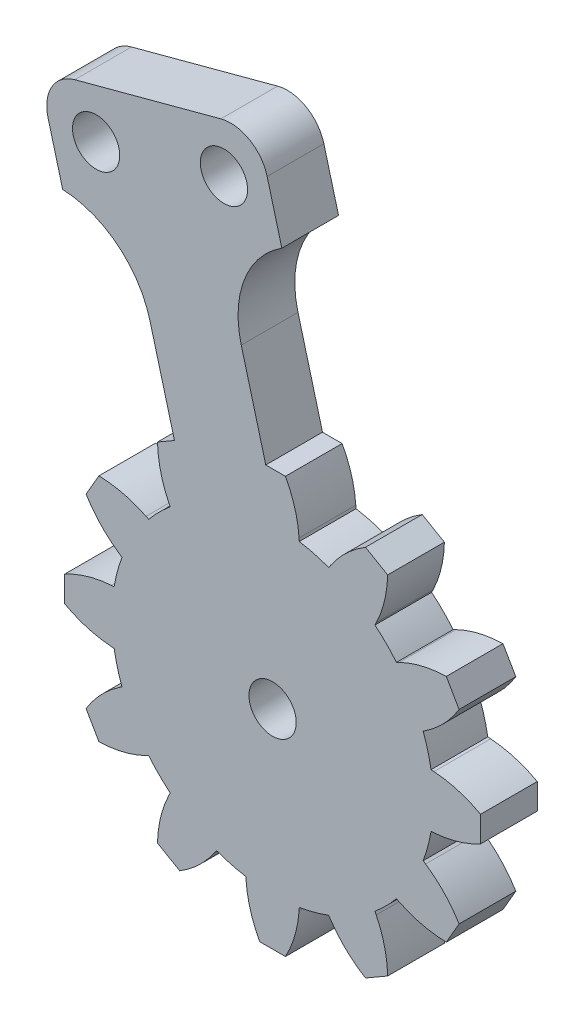
from build123d import *

# Parameters (mm, degrees)
SKETCH1_R           = 8.5
BOSS_EXTRUDE1_DEPTH = 3
BOSS_EXTRUDE2_DEPTH = 3
CIRPATTERN2_COUNT   = 12
FILLET5_R           = 6
FILLET6_R           = 6
BOSS_EXTRUDE5_DEPTH = 3
SKETCH15_R          = 5
BOSS_EXTRUDE6_DEPTH = 1.9
SKETCH14_R          = 1.25
CUT_EXTRUDE7_DEPTH  = 28.730582035
SKETCH17_R          = 1.25
CUT_EXTRUDE9_DEPTH  = 28.730582035
FILLET7_R           = 2.5
BOSS_EXTRUDE7_DEPTH = 3
SKETCH20_R          = 1.25
CUT_EXTRUDE10_DEPTH = 3
FILLET8_R           = 5
FILLET9_R           = 5
FILLET10_R          = 2
FILLET11_R          = 2


# Some blends are built 0.0001 mm under size
with BuildPart() as part:
    # Sketch1 → Boss-Extrude1 (new body)
    with BuildSketch(Plane.XY):
        Circle(SKETCH1_R)
    extrude(amount=BOSS_EXTRUDE1_DEPTH)

    # Sketch3 → Boss-Extrude2 (add)
    with BuildSketch(Plane.XY.offset(3)):
        Polygon((-1.305261922, 9.914448614), (-1.509060022, 7), (1.509060022, 7), (1.305261922, 9.914448614), (0.678518537, 11), (-0.678518537, 11), align=None)
    boss_extrude2 = extrude(amount=-BOSS_EXTRUDE2_DEPTH)

    # CirPattern2: Boss-Extrude2 ×12 about axis
    cirpattern2_axis = Axis((0, 0, 0), (0, 0, 1))
    for i in range(1, CIRPATTERN2_COUNT):
        add(boss_extrude2.rotate(cirpattern2_axis, i * 360 / CIRPATTERN2_COUNT))

    # Fillet5
    # the kernel refuses this fillet: 6 mm, written as the material it takes off along each edge
    with BuildSketch(Plane(origin=(9.238795325, 3.826834324, 6.454382408), x_dir=(0.4999999999998129, 0.8660254037845467, 0), z_dir=(0, 0, -1)), Plane(origin=(1.305261922, 9.914448614, 6.454382408), x_dir=(-0.5000000000001841, 0.8660254037843323, 0), z_dir=(0, 0, -1)), Plane(origin=(-7.933533403, 6.08761429, 6.454382408), x_dir=(-1, 0, 0), z_dir=(0, 0, -1)), Plane(origin=(-9.914448614, 1.305261922, 6.454382408), x_dir=(-0.8660254037843317, -0.5000000000001852, 0), z_dir=(0, 0, -1)), Plane(origin=(-9.238795325, -3.826834324, 6.454382408), x_dir=(-0.49999999999981826, -0.8660254037845436, 0), z_dir=(0, 0, -1)), Plane(origin=(-6.08761429, -7.933533403, 6.454382408), x_dir=(0, -1, 0), z_dir=(0, 0, -1)), Plane(origin=(3.826834324, -9.238795325, 6.454382408), x_dir=(0.866025403784545, -0.49999999999981576, 0), z_dir=(0, 0, -1)), Plane(origin=(7.933533403, -6.08761429, 6.454382408), x_dir=(1, 0, 0), z_dir=(0, 0, -1)), Plane(origin=(9.914448614, -1.305261922, 6.454382408), x_dir=(0.8660254037843321, 0.5000000000001844, 0), z_dir=(0, 0, -1))) as fillet5_piece_1:
        with BuildLine():
            CenterArc((1.388315544, -5.998484909), FILLET5_R, 91.287628333, 24.712371667)
            Line((-1.241911337, -0.605720631), (-1.294515874, -0.497865346))
            Line((-1.294515874, -0.497865346), (-0.052604538, 0.107855286))
            Line((-0.052604538, 0.107855286), (0, 0.12))
            ThreePointArc((0, 0.12), (0.626743385, 0.12), (1.250790195, 0.119969698))
            Line((1.250790195, 0.119969698), (1.25348677, 0))
        make_face()
    extrude(amount=9.908764816, mode=Mode.SUBTRACT)
    with BuildSketch(Plane(origin=(6.08761429, 7.933533403, 6.454382408), x_dir=(-0.4383711467890806, -0.8987940462991654, 0), z_dir=(0, 0, -1)), Plane(origin=(-3.826834324, 9.238795325, 6.454382408), x_dir=(0.5591929034707435, -0.8290375725550441, 0), z_dir=(0, 0, -1)), Plane(origin=(-1.305261922, -9.914448614, 6.454382408), x_dir=(-0.06975647374412178, 0.9975640502598244, 0), z_dir=(0, 0, -1))) as fillet5_piece_2:
        with BuildLine():
            CenterArc((1.381752963, 6), FILLET5_R, 245.287628333, 24.712371667)
            Line((-1.126626446, 0.549492433), (-1.176794034, 0.440482282))
            ThreePointArc((-1.176794034, 0.440482282), (-0.615917761, 0.166890931), (-0.052604538, -0.107855286))
            Line((-0.052604538, -0.107855286), (0, -0.12))
            Line((0, -0.12), (1.381752963, -0.12))
            Line((1.381752963, -0.12), (1.381752963, 0))
        make_face()
    extrude(amount=9.908764816, mode=Mode.SUBTRACT)

    # Fillet6
    # the kernel refuses this fillet: 6 mm, written as the material it takes off along each edge
    with BuildSketch(Plane(origin=(7.933533403, 6.08761429, 6.454382408), x_dir=(-0.8987940462991681, -0.4383711467890748, 0), z_dir=(0, 0, -1)), Plane(origin=(3.826834324, 9.238795325, 6.454382408), x_dir=(-0.5591929034707512, -0.8290375725550386, 0), z_dir=(0, 0, -1)), Plane(origin=(-1.305261922, 9.914448614, 6.454382408), x_dir=(-0.06975647374412959, -0.9975640502598239, 0), z_dir=(0, 0, -1)), Plane(origin=(-6.08761429, 7.933533403, 6.454382408), x_dir=(0.43837114678907496, -0.8987940462991681, 0), z_dir=(0, 0, -1)), Plane(origin=(-9.238795325, 3.826834324, 6.454382408), x_dir=(0.8290375725550394, -0.5591929034707502, 0), z_dir=(0, 0, -1)), Plane(origin=(-9.914448614, -1.305261922, 6.454382408), x_dir=(0.9975640502598241, -0.06975647374412908, 0), z_dir=(0, 0, -1)), Plane(origin=(-7.933533403, -6.08761429, 6.454382408), x_dir=(0.8987940462991686, 0.4383711467890744, 0), z_dir=(0, 0, -1)), Plane(origin=(-3.826834324, -9.238795325, 6.454382408), x_dir=(0.559192903470749, 0.8290375725550401, 0), z_dir=(0, 0, -1)), Plane(origin=(1.305261922, -9.914448614, 6.454382408), x_dir=(0.06975647374412973, 0.9975640502598241, 0), z_dir=(0, 0, -1)), Plane(origin=(6.08761429, -7.933533403, 6.454382408), x_dir=(-0.4383711467890742, 0.8987940462991686, 0), z_dir=(0, 0, -1)), Plane(origin=(9.238795325, -3.826834324, 6.454382408), x_dir=(-0.8290375725550386, 0.5591929034707512, 0), z_dir=(0, 0, -1)), Plane(origin=(9.914448614, 1.305261922, 6.454382408), x_dir=(-0.9975640502598239, 0.06975647374412945, 0), z_dir=(0, 0, -1))) as fillet6_piece_1:
        with BuildLine():
            CenterArc((1.381752963, -6), FILLET6_R, 90, 24.712371667)
            Line((-1.126626446, -0.549492433), (-1.176794034, -0.440482282))
            ThreePointArc((-1.176794034, -0.440482282), (-0.615917761, -0.166890931), (-0.052604538, 0.107855286))
            Line((-0.052604538, 0.107855286), (0, 0.12))
            Line((0, 0.12), (1.381752963, 0.12))
            Line((1.381752963, 0.12), (1.381752963, 0))
        make_face()
    extrude(amount=9.908764816, mode=Mode.SUBTRACT)

    # Sketch12 → Boss-Extrude5 (add)
    with BuildSketch(Plane(origin=(0, 0, 0), x_dir=(-1, 0, 0), z_dir=(0, 0, -1))):
        Polygon((1.535905814, 15.391336798), (-4.226547881, -6.114433171), (0.60308125, -7.408528397), (9.014700216, 23.984060958), (4.185071084, 25.278156183), align=None)
    extrude(amount=-BOSS_EXTRUDE5_DEPTH)

    # Sketch15 → Boss-Extrude6 (add)
    with BuildSketch(Plane(origin=(0, 0, 0), x_dir=(-1, 0, 0), z_dir=(0, 0, -1))):
        Circle(SKETCH15_R)
    extrude(amount=-BOSS_EXTRUDE6_DEPTH)

    # Sketch14 → Cut-Extrude7 (cut, through all)
    with BuildSketch(Plane(origin=(0, 0, 0), x_dir=(-1, 0, 0), z_dir=(0, 0, -1))):
        Circle(SKETCH14_R)
    extrude(amount=-CUT_EXTRUDE7_DEPTH, mode=Mode.SUBTRACT)

    # Sketch17 → Cut-Extrude9 (cut, through all)
    with BuildSketch(Plane.XY.offset(3)):
        with Locations((-5.952838037, 22.216294005)):
            Circle(SKETCH17_R)
    extrude(amount=-CUT_EXTRUDE9_DEPTH, mode=Mode.SUBTRACT)

    # Fillet7
    fillet7_edges = [part.edges().sort_by_distance(p)[0] for p in [
        (-9.014700216, 23.984060958, 1.5),
        (-4.185071084, 25.278156183, 1.5),
    ]]
    fillet(fillet7_edges, radius=FILLET7_R - 0.0001)  # a hair under: the kernel refuses the full size

    # Sketch19 → Boss-Extrude7 (add)
    with BuildSketch(Plane.XY.offset(3)):
        Polygon((-6.59988565, 24.63110857), (-12.395440608, 23.0781943), (-11.101345382, 18.248565168), (0.489764533, 21.35439371), (-0.804330692, 26.184022841), align=None)
    extrude(amount=-BOSS_EXTRUDE7_DEPTH)

    # Sketch20 → Cut-Extrude10 (cut)
    with BuildSketch(Plane.XY.offset(3)):
        with Locations((-9.333578429, 21.310427347)):
            Circle(SKETCH20_R)
        with Locations((-2.572097645, 23.122160663)):
            Circle(SKETCH20_R)
    extrude(amount=-CUT_EXTRUDE10_DEPTH, mode=Mode.SUBTRACT)

    # Fillet8
    # the kernel refuses this fillet: 5 mm, written as the material it adds along each edge
    with BuildSketch(Plane(origin=(-7.72060499, 19.154431826, 0), x_dir=(-0.9659258262890523, -0.25881904510258064, 0), z_dir=(0, 0, 1))) as fillet8_piece_1:
        with BuildLine():
            CenterArc((5, 4.769696007), FILLET8_R, 180, 72.542396876)
            Line((0, 4.769696007), (-0.1, 4.769696007))
            Line((-0.1, 4.769696007), (-0.1, 0))
            Line((-0.1, 0), (0, -0.1))
            ThreePointArc((0, -0.1), (1.75, -0.1), (3.47, -0.09539392))
            Line((3.47, -0.09539392), (3.5, 0))
        make_face()
    extrude(amount=3)

    # Fillet9
    # the kernel refuses this fillet: 5 mm, written as the material it adds along each edge
    with BuildSketch(Plane(origin=(-2.890975859, 20.448527052, 3), x_dir=(0.9659258262890524, 0.25881904510257997, 0), z_dir=(0, 0, -1))) as fillet9_piece_1:
        with BuildLine():
            CenterArc((5, 4.769696007), FILLET9_R, 180, 72.542396876)
            Line((0, 4.769696007), (-0.1, 4.769696007))
            Line((-0.1, 4.769696007), (-0.1, 0))
            Line((-0.1, 0), (0, -0.1))
            ThreePointArc((0, -0.1), (1.75, -0.1), (3.47, -0.09539392))
            Line((3.47, -0.09539392), (3.5, 0))
        make_face()
    extrude(amount=3)

    # Fillet10
    fillet10_edges = [part.edges().sort_by_distance(p)[0] for p in [
        (-0.804330692, 26.184022841, 1.5),
    ]]
    fillet(fillet10_edges, radius=FILLET10_R)

    # Fillet11
    fillet11_edges = [part.edges().sort_by_distance(p)[0] for p in [
        (-12.395440608, 23.0781943, 1.5),
    ]]
    fillet(fillet11_edges, radius=FILLET11_R)


solid = part.part
